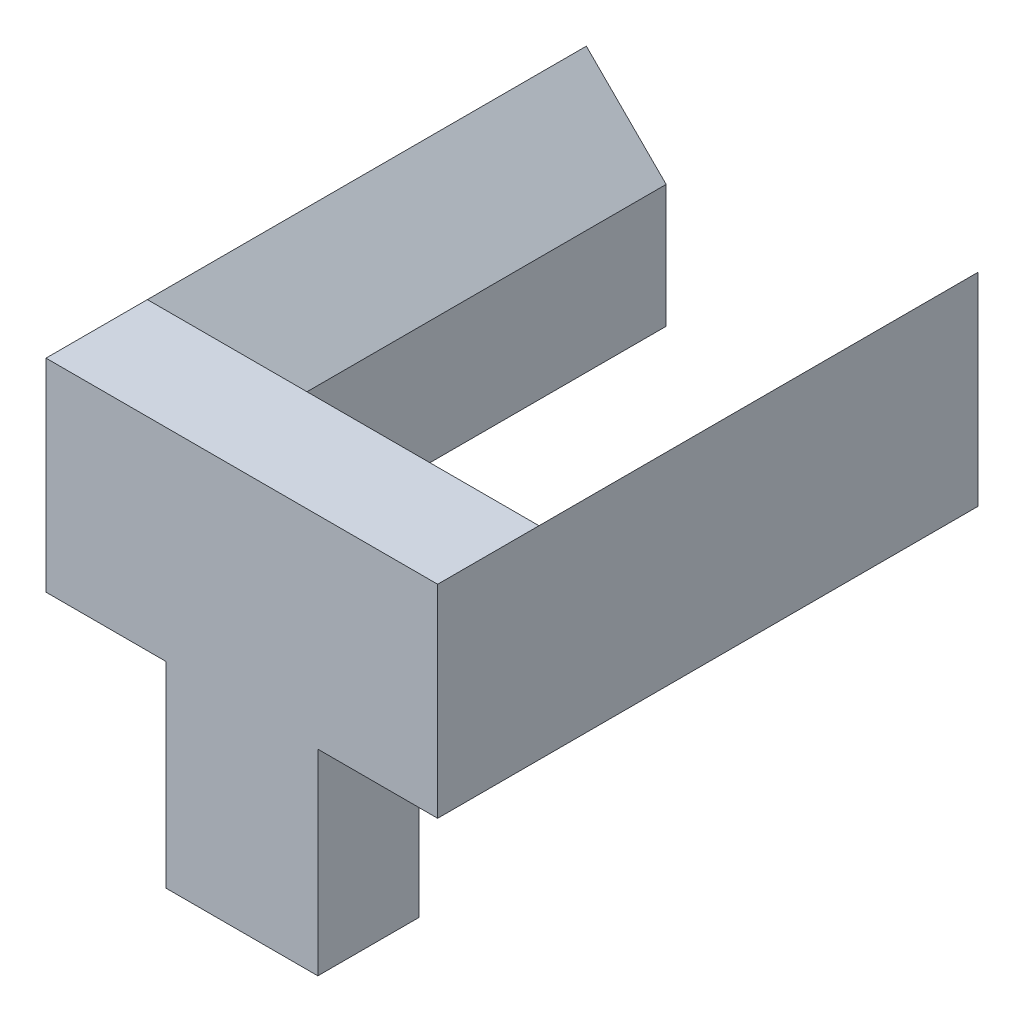
from build123d import *

# Parameters (mm, degrees)
SKETCH1_W           = 38.1
SKETCH1_H           = 25.4
BOSS_EXTRUDE1_DEPTH = 99.9998
SKETCH2_W           = 25.4
SKETCH2_H           = 50.8
BOSS_EXTRUDE2_DEPTH = 30.0228
SKETCH3_W           = 25.4
SKETCH3_H           = 50.8
BOSS_EXTRUDE3_DEPTH = 30.0228
BOSS_EXTRUDE4_DEPTH = 110.0074
BOSS_EXTRUDE5_DEPTH = 110.0074
SKETCH8_R           = 3.175
CUT_EXTRUDE1_DEPTH  = 12.7


with BuildPart() as part:
    # Sketch1 → Boss-Extrude1 (new body)
    with BuildSketch(Plane(origin=(0, 0, 0), x_dir=(1, 0, 0), z_dir=(0, 1, 0))):
        with Locations((5.061883246, 0.142486096)):
            Rectangle(SKETCH1_W, SKETCH1_H)
    extrude(amount=BOSS_EXTRUDE1_DEPTH)

    # Sketch2 → Boss-Extrude2 (add)
    with BuildSketch(Plane(origin=(24.111883246, 0, 0), x_dir=(0, 0, -1), z_dir=(1, 0, 0))):
        with Locations((0.142486096, 74.5998)):
            Rectangle(SKETCH2_W, SKETCH2_H)
    extrude(amount=BOSS_EXTRUDE2_DEPTH)

    # Sketch3 → Boss-Extrude3 (add)
    with BuildSketch(Plane.ZY.offset(13.988116754)):
        with Locations((-0.142486096, 74.5998)):
            Rectangle(SKETCH3_W, SKETCH3_H)
    extrude(amount=BOSS_EXTRUDE3_DEPTH)

    # Sketch4 → Boss-Extrude4 (add)
    with BuildSketch(Plane(origin=(0, 0, -12.842486096), x_dir=(-1, 0, 0), z_dir=(0, 0, -1))):
        Polygon((-54.134683246, 99.9998), (-54.134683246, 49.1998), (-36.166683176, 49.1998), (-36.166683176, 79.99979993), align=None)
    extrude(amount=BOSS_EXTRUDE4_DEPTH)

    # Sketch5 → Boss-Extrude5 (add)
    with BuildSketch(Plane(origin=(0, 0, -12.842486096), x_dir=(-1, 0, 0), z_dir=(0, 0, -1))):
        Polygon((44.010916754, 99.9998), (44.010916754, 49.1998), (24.010916684, 49.1998), (24.010916684, 79.99979993), align=None)
    extrude(amount=BOSS_EXTRUDE5_DEPTH)

    # Sketch8 → Cut-Extrude1 (cut)
    with BuildSketch(Plane.XZ):
        with Locations((-5.352116754, -0.142486096)):
            Circle(SKETCH8_R)
        with Locations((17.507883246, -0.142486096)):
            Circle(SKETCH8_R)
    extrude(amount=-CUT_EXTRUDE1_DEPTH, mode=Mode.SUBTRACT)


solid = part.part
